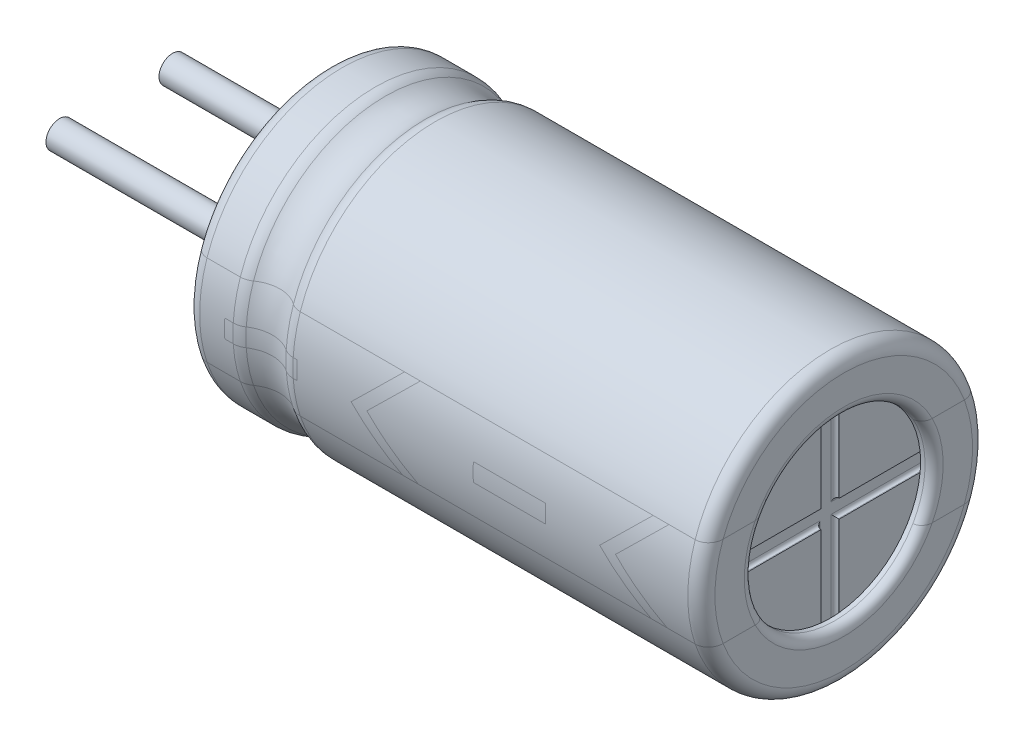
from build123d import *

# Parameters (mm, degrees)
FILLET_1_R          = 0.4
SKETCH_2_R          = 2
CUT_EXTRUDE_1_DEPTH = 0.3
FILLET_2_R          = 0.2
FILLET_3_R          = 0.3
CUT_EXTRUDE_2_DEPTH = 0.1
CUT_EXTRUDE_START   = -0.3
SKETCH_5_R          = 2
CUT_EXTRUDE_3_DEPTH = 0.3
FILLET_6_R          = 0.3
SKETCH_6_R          = 0.3
EXTRUDE_1_DEPTH     = 5
FILLET_7_R          = 0.08


with BuildPart() as part:
    # Эскиз1 → Повернуть1 (revolve)
    with BuildSketch(Plane(origin=(0, 0, 0), x_dir=(1, 0, 0), z_dir=(0, 1, 0)), mode=Mode.PRIVATE) as revolve_1_sk:
        with BuildLine():
            Line((0, 0), (0, 3.15))
            Line((0, 3.15), (1.170849738, 3.15))
            ThreePointArc((1.170849738, 3.15), (1.7, 2.95), (2.229150262, 3.15))
            Line((2.229150262, 3.15), (11.4, 3.15))
            Line((11.4, 3.15), (11.4, 0))
            Line((11.4, 0), (0, 0))
        make_face()
    revolve(revolve_1_sk.sketch.rotate(Axis((-17.233728413, 0, 0), (1, 0, 0)), 180), axis=Axis((-17.233728413, 0, 0), (1, 0, 0)))

    # Скругление1
    fillet_1_edges = [part.edges().sort_by_distance(p)[0] for p in [
        (1.170849738, 0, -3.15),
        (2.229150262, 0, -3.15),
    ]]
    fillet(fillet_1_edges, radius=FILLET_1_R)

    # Эскиз2 → Вырез-Вытянуть1 (cut)
    with BuildSketch(Plane(origin=(11.4, 0, 0), x_dir=(0, 0, -1), z_dir=(1, 0, 0))):
        Circle(SKETCH_2_R)
    extrude(amount=-CUT_EXTRUDE_1_DEPTH, mode=Mode.SUBTRACT)

    # Скругление2
    fillet_2_edges = [part.edges().sort_by_distance(p)[0] for p in [
        (11.4, 0, 2),
    ]]
    fillet(fillet_2_edges, radius=FILLET_2_R)

    # Скругление3
    fillet_3_edges = [part.edges().sort_by_distance(p)[0] for p in [
        (11.4, 0, -3.15),
    ]]
    fillet(fillet_3_edges, radius=FILLET_3_R)

    # Эскиз3 → Вырез-Вытянуть2 (cut)
    with BuildSketch(Plane(origin=(11.1, 0, 0), x_dir=(0, 0, -1), z_dir=(1, 0, 0))):
        with BuildLine():
            Line((-0.2, 2.364762642), (-0.2, 0.2))
            Line((-0.2, 0.2), (-2.364762642, 0.2))
            ThreePointArc((-2.364762642, 0.2), (-2.373205081, 0), (-2.364762642, -0.2))
            Line((-2.364762642, -0.2), (-0.2, -0.2))
            Line((-0.2, -0.2), (-0.2, -2.364762642))
            ThreePointArc((-0.2, -2.364762642), (0, -2.373205081), (0.2, -2.364762642))
            Line((0.2, -2.364762642), (0.2, -0.2))
            Line((0.2, -0.2), (2.364762642, -0.2))
            ThreePointArc((2.364762642, -0.2), (2.373205081, 0), (2.364762642, 0.2))
            Line((2.364762642, 0.2), (0.2, 0.2))
            Line((0.2, 0.2), (0.2, 2.364762642))
            ThreePointArc((0.2, 2.364762642), (0, 2.373205081), (-0.2, 2.364762642))
        make_face()
    extrude(amount=-CUT_EXTRUDE_2_DEPTH, mode=Mode.SUBTRACT)

    # Эскиз5 → Вырез-Вытянуть3 (cut)
    with BuildSketch(Plane.ZY.offset(CUT_EXTRUDE_START)):
        with Locations(Location((0, 0, 0), (0, 0, 185.739170477))):
            Circle(SKETCH_5_R)
    extrude(amount=CUT_EXTRUDE_3_DEPTH, mode=Mode.SUBTRACT)

    # Скругление6
    fillet_6_edges = [part.edges().sort_by_distance(p)[0] for p in [
        (0, 0, -3.15),
        (0, 0.2, 1.989974874),
    ]]
    fillet(fillet_6_edges, radius=FILLET_6_R - 0.0001)  # a hair under: the kernel refuses the full size

    # Эскиз6 → Бобышка-Вытянуть1 (add)
    with BuildSketch(Plane.ZY.offset(-0.3)):
        with Locations((-1.25, 0)):
            Circle(SKETCH_6_R)
        with Locations(Location((1.25, 0, 0), (0, 0, 180))):
            Circle(SKETCH_6_R)
    extrude(amount=EXTRUDE_1_DEPTH)

    # Скругление7
    fillet_7_edges = [part.edges().sort_by_distance(p)[0] for p in [
        (11, 1.282381321, -0.2),
        (11, 0.2, -1.282381321),
        (11, -0.2, -1.282381321),
        (11, -1.282381321, -0.2),
        (11, -1.282381321, 0.2),
        (11, -0.2, 1.282381321),
        (11, 0.2, 1.282381321),
        (11, 1.282381321, 0.2),
    ]]
    fillet(fillet_7_edges, radius=FILLET_7_R)


solid = part.part
